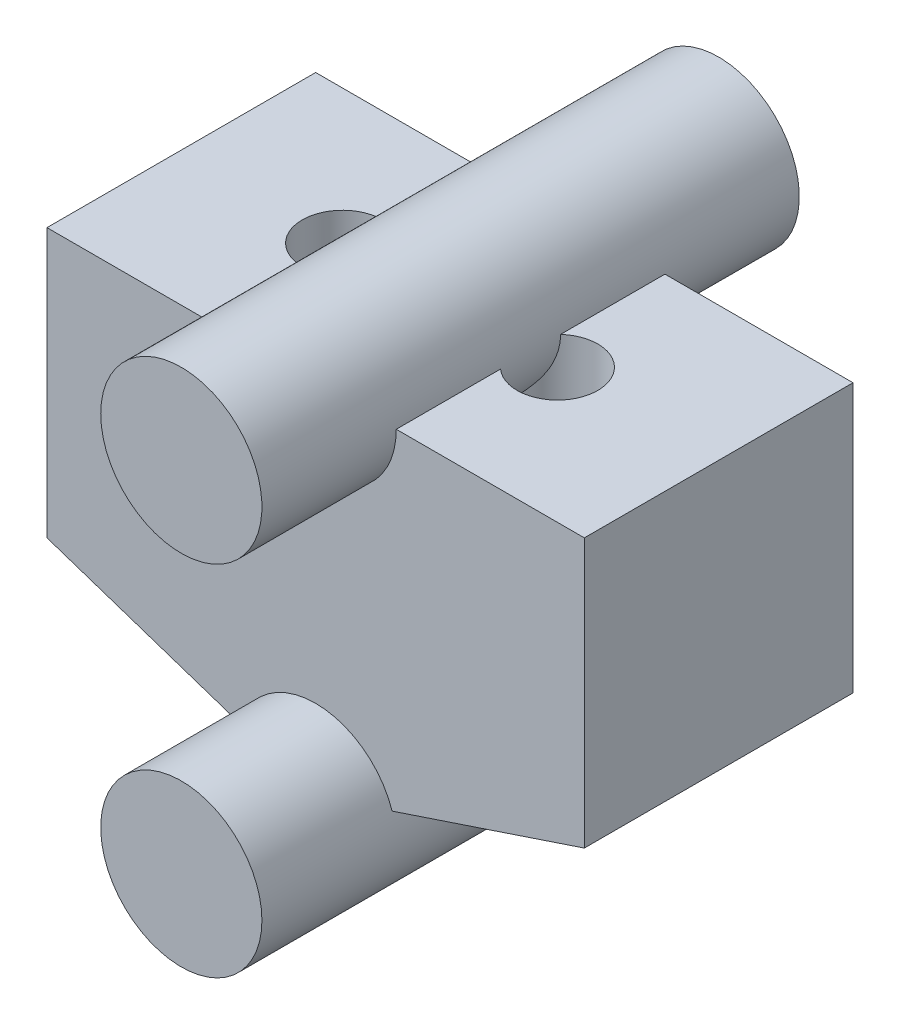
from build123d import *

# Parameters (mm, degrees)
BOSS_EXTRUDE1_DEPTH      = 10
BOSS_EXTRUDE2_DEPTH      = 15
BOSS_EXTRUDE2_DEPTH_BACK = 5
SKETCH2_R                = 1.5
CUT_EXTRUDE1_DEPTH       = 25.326483054
BOSS_EXTRUDE3_DEPTH      = 5
BOSS_EXTRUDE3_DEPTH_BACK = 15
SKETCH3_R                = 3


with BuildPart() as part:
    # Sketch1 → Boss-Extrude1 (new body)
    with BuildSketch(Plane.XY):
        with BuildLine():
            Line((-10, 5), (-10, -5))
            Line((-10, -5), (-2.846049894, -7.384650035))
            ThreePointArc((-2.846049894, -7.384650035), (0, -5.333333333), (2.846049894, -7.384650035))
            Line((2.846049894, -7.384650035), (10, -5))
            Line((10, -5), (10, 5))
            Line((10, 5), (-10, 5))
        make_face()
    extrude(amount=BOSS_EXTRUDE1_DEPTH)

    # Sketch1<3> → Boss-Extrude2 (add, two sides: drawn at the far end of the back side and taken through both)
    with BuildSketch(Plane.XY.offset(-BOSS_EXTRUDE2_DEPTH_BACK)):
        with BuildLine():
            ThreePointArc((2.846049894, -7.384650035), (0, -5.333333333), (-2.846049894, -7.384650035))
            ThreePointArc((-2.846049894, -7.384650035), (-0.480546729, -11.294595706), (3, -8.333333333))
            ThreePointArc((3, -8.333333333), (2.961262373, -7.852786604), (2.846049894, -7.384650035))
        make_face()
    extrude(amount=BOSS_EXTRUDE2_DEPTH + BOSS_EXTRUDE2_DEPTH_BACK)

    # Sketch2 → Cut-Extrude1 (cut, through all)
    with BuildSketch(Plane(origin=(0, 5, 0), x_dir=(1, 0, 0), z_dir=(0, 1, 0))):
        with Locations((-4, -5)):
            Circle(SKETCH2_R)
        with Locations((4, -5)):
            Circle(SKETCH2_R)
    extrude(amount=-CUT_EXTRUDE1_DEPTH, mode=Mode.SUBTRACT)

    # Sketch3 → Boss-Extrude3 (add, two sides: drawn at the far end of the back side and taken through both)
    with BuildSketch(Plane(origin=(0, 0, 0), x_dir=(-1, 0, 0), z_dir=(0, 0, -1)).offset(-BOSS_EXTRUDE3_DEPTH_BACK)):
        with Locations((0, 5)):
            Circle(SKETCH3_R)
    extrude(amount=BOSS_EXTRUDE3_DEPTH + BOSS_EXTRUDE3_DEPTH_BACK)


solid = part.part
